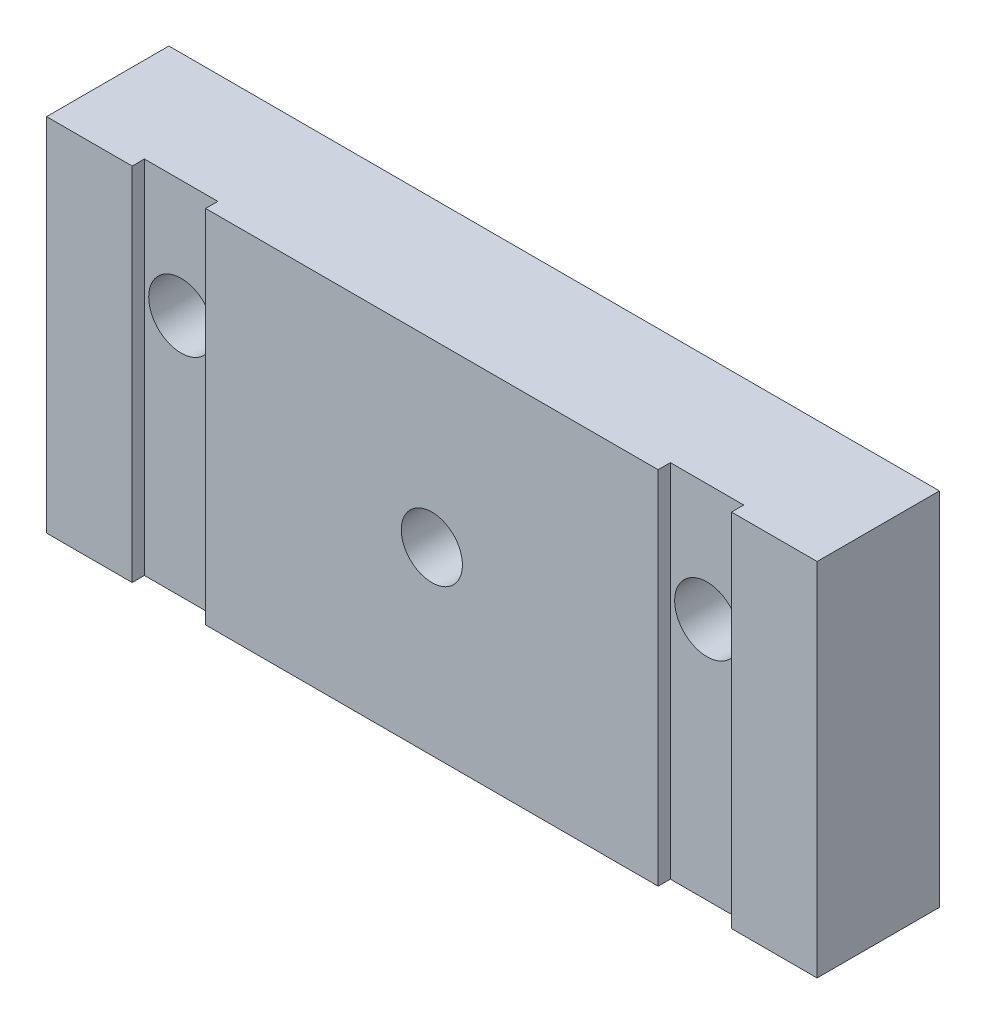
from build123d import *

# Parameters (mm, degrees)
SKETCH1_W           = 63
SKETCH1_H           = 32.600874907
BOSS_EXTRUDE1_DEPTH = 10
SKETCH2_R           = 2.5
CUT_EXTRUDE1_DEPTH  = 68.752616876
SKETCH3_R           = 2.65
CUT_EXTRUDE2_DEPTH  = 68.752616876
SKETCH4_OUTSIDE_W   = 79.328
SKETCH4_OUTSIDE_H   = 48.929
SKETCH4_OUTSIDE_W_2 = 63
SKETCH4_OUTSIDE_H_2 = 29.491577432
CUT_EXTRUDE3_DEPTH  = 10
CUT_EXTRUDE5_DEPTH  = 62.471563665


with BuildPart() as part:
    # Sketch1 → Boss-Extrude1 (new body)
    with BuildSketch(Plane.XY):
        with Locations((21.5, -24.704648738)):
            Rectangle(SKETCH1_W, SKETCH1_H)
    extrude(amount=BOSS_EXTRUDE1_DEPTH)

    # Sketch2 → Cut-Extrude1 (cut, through all)
    with BuildSketch(Plane.XY.offset(10)):
        with Locations((21.5, -23.15)):
            Circle(SKETCH2_R)
    extrude(amount=-CUT_EXTRUDE1_DEPTH, mode=Mode.SUBTRACT)

    # Sketch3 → Cut-Extrude2 (cut, through all)
    with BuildSketch(Plane(origin=(0, 0, 0), x_dir=(-1, 0, 0), z_dir=(0, 0, -1))):
        with Locations((0, -18)):
            Circle(SKETCH3_R)
        with Locations((-43, -18)):
            Circle(SKETCH3_R)
    extrude(amount=-CUT_EXTRUDE2_DEPTH, mode=Mode.SUBTRACT)

    # Sketch4 outside → Cut-Extrude3 (cut)
    with BuildSketch(Plane.XY.offset(10)):
        with Locations((21.5, -24.7045)):
            Rectangle(SKETCH4_OUTSIDE_W, SKETCH4_OUTSIDE_H)
        with Locations((21.5, -23.15)):
            Rectangle(SKETCH4_OUTSIDE_W_2, SKETCH4_OUTSIDE_H_2, mode=Mode.SUBTRACT)
    extrude(amount=-CUT_EXTRUDE3_DEPTH, mode=Mode.SUBTRACT)

    # Sketch5 → Cut-Extrude5 (cut, through all)
    with BuildSketch(Plane.XZ.offset(37.895788716)):
        Polygon((-10, 19.655092594), (-10, 10), (-3, 10), (-3, 9), (3, 9), (3, 10), (40, 10), (40, 9), (46, 9), (46, 10), (53, 10), (53, 19.655092594), align=None)
    extrude(amount=-CUT_EXTRUDE5_DEPTH, mode=Mode.SUBTRACT)


solid = part.part
